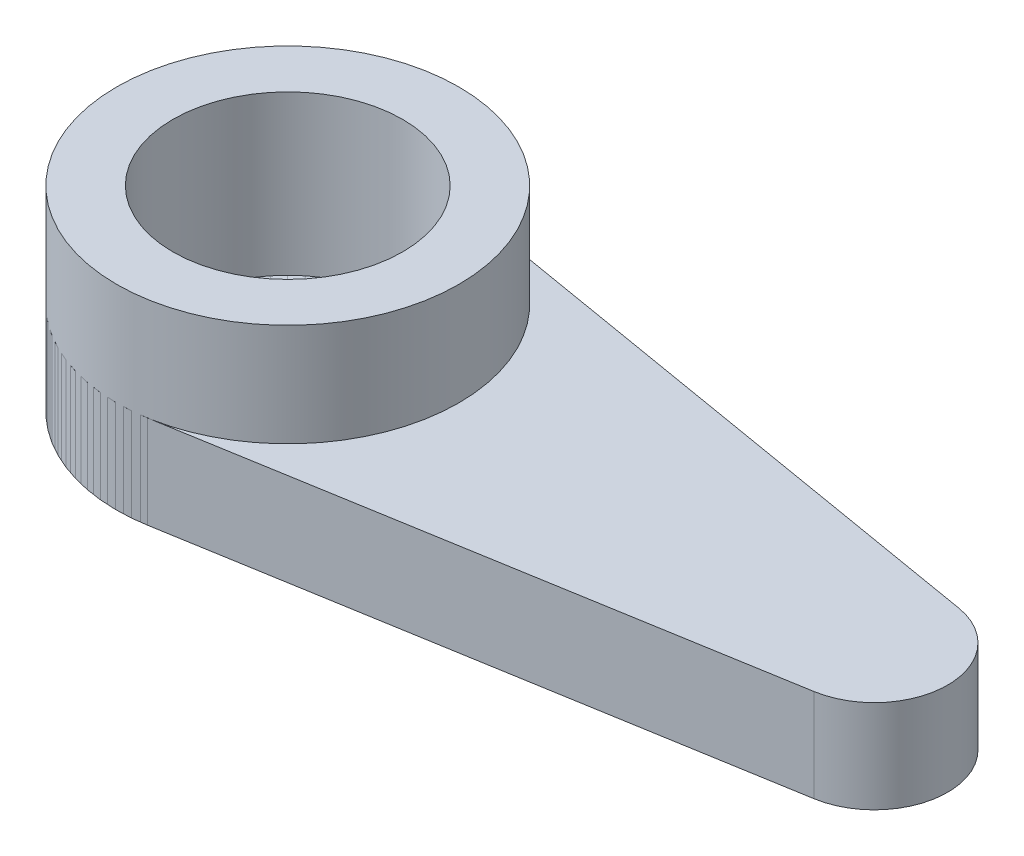
from build123d import *

# Parameters (mm, degrees)
SKETCH1_R           = 3.5
SKETCH1_R_2         = 1.5
BOSS_EXTRUDE1_DEPTH = 4
SKETCH2_R           = 1.5
BOSS_EXTRUDE2_DEPTH = 1.9
SKETCH3_R           = 2.35
CUT_EXTRUDE1_DEPTH  = 3.25


with BuildPart() as part:
    # Sketch1 → Boss-Extrude1 (new body)
    with BuildSketch(Plane(origin=(0, 0, 0), x_dir=(1, 0, 0), z_dir=(0, 1, 0))):
        Circle(SKETCH1_R)
        Circle(SKETCH1_R_2, mode=Mode.SUBTRACT)
    extrude(amount=BOSS_EXTRUDE1_DEPTH)


with BuildPart() as body_2:
    # Sketch2 → Boss-Extrude2 (new body)
    with BuildSketch(Plane.XZ):
        with BuildLine():
            Line((0.583333333, 3.45104654), (12.25, 1.479019946))
            ThreePointArc((12.25, 1.479019946), (13.5, 0), (12.25, -1.479019946))
            Line((12.25, -1.479019946), (0.583333333, -3.45104654))
            ThreePointArc((0.583333333, -3.45104654), (-3.5, 0), (0.583333333, 3.45104654))
        make_face()
        Circle(SKETCH2_R, mode=Mode.SUBTRACT)
    extrude(amount=-BOSS_EXTRUDE2_DEPTH)


with BuildPart() as cut_extrude1_tool:
    # Sketch3 → Cut-Extrude1 (new body)
    with BuildSketch(Plane(origin=(0, 4, 0), x_dir=(1, 0, 0), z_dir=(0, 1, 0))):
        Circle(SKETCH3_R)
    extrude(amount=-CUT_EXTRUDE1_DEPTH)


with BuildPart() as part_1:
    add(part.part)

    # Cut-Extrude1: cut by cut_extrude1_tool
    add(cut_extrude1_tool.part, mode=Mode.SUBTRACT)


with BuildPart() as body_2_1:
    add(body_2.part)

    # Cut-Extrude1: cut by cut_extrude1_tool
    add(cut_extrude1_tool.part, mode=Mode.SUBTRACT)


solid = Compound([part_1.part, body_2_1.part])
